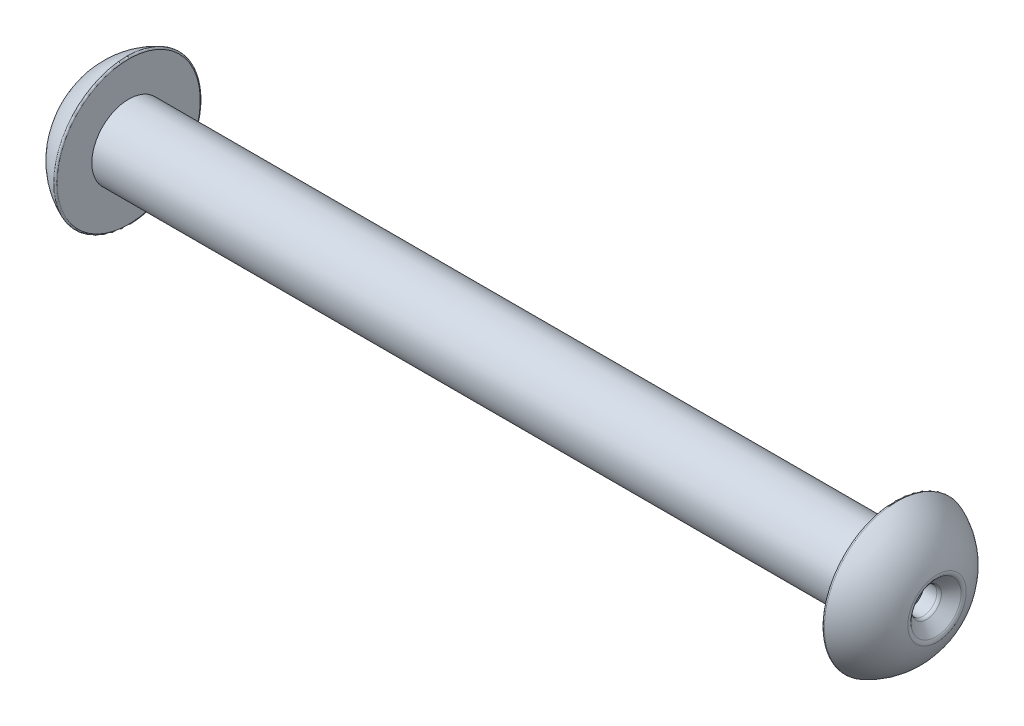
from build123d import *

# Parameters (mm, degrees)
SKETCH1_R           = 2.5000000000000004
BOSS_EXTRUDE1_DEPTH = 52
SKETCH2_R           = 5
BOSS_EXTRUDE2_DEPTH = 3
FILLET1_R           = 4.5
FILLET2_R           = 0.1
SKETCH3_R           = 0.9141726050679063
CUT_EXTRUDE2_DEPTH  = 2
CHAMFER2_SIZE       = 0.966893524
FILLET4_R           = 0.3


with BuildPart() as part:
    # Sketch1 → Boss-Extrude1 (new body)
    with BuildSketch(Plane(origin=(0, 0, 0), x_dir=(0, 0, -1), z_dir=(1, 0, 0))):
        with Locations(Location((0, 0, 0), (0, 0, 180))):
            Circle(SKETCH1_R)
    extrude(amount=BOSS_EXTRUDE1_DEPTH)

    # Sketch2 → Boss-Extrude2 (add)
    with BuildSketch(Plane(origin=(52, 0, 0), x_dir=(0, 0, -1), z_dir=(1, 0, 0))):
        Circle(SKETCH2_R)
    extrude(amount=BOSS_EXTRUDE2_DEPTH)

    # Fillet1
    # the kernel refuses this fillet: 4.5 mm, written as the material it takes off along each edge
    with BuildSketch(Plane(origin=(55, 0, 0), x_dir=(0, 0, -1), z_dir=(0, -1, 0))) as fillet1_piece_1:
        with BuildLine():
            CenterArc((0.7573593128807142, -4.5), FILLET1_R, 19.471220634490688, 70.52877936550931)
            Line((0.7573593128807142, 0), (0.7573593128807142, 0.09000000000000341))
            Line((0.7573593128807142, 0.09000000000000341), (5, 0.09000000000000341))
            Line((5, 0.09000000000000341), (5.09, 0))
            ThreePointArc((5.09, 0), (5.09, -1.5), (5.084852813742386, -2.969999999999999))
            Line((5.084852813742386, -2.969999999999999), (5, -3))
        make_face()
    revolve(axis=Axis((55, 0, 0), (1, 0, 0)), mode=Mode.SUBTRACT)

    # Fillet2
    fillet2_edges = [part.edges().sort_by_distance(p)[0] for p in [
        (52, 6.1e-16, 5),
    ]]
    fillet(fillet2_edges, radius=FILLET2_R)

    # Sketch3 → Cut-Extrude2 (cut)
    with BuildSketch(Plane(origin=(55, 0, 0), x_dir=(0, 0, -1), z_dir=(1, 0, 0))):
        Circle(SKETCH3_R)
    extrude(amount=-CUT_EXTRUDE2_DEPTH, mode=Mode.SUBTRACT)

    # Chamfer2
    # the kernel refuses this chamfer: 1, 0.966893524 mm, written as the material it takes off along each edge
    with BuildSketch(Plane(origin=(54.99726690239676, -1.3886838e-10, -1.3383106e-10), x_dir=(0, 1.519058447411492e-10, -1.0), z_dir=(0, 1.0, 1.519058447411492e-10))) as chamfer2_piece_1:
        with BuildLine():
            Line((1.8179357472686162, 0.12403267277841934), (0.9141726049340748 + CHAMFER2_SIZE * 2.76827336351e-10, CHAMFER2_SIZE))
            Line((0.9141726049340748 + CHAMFER2_SIZE * 2.76827336351e-10, CHAMFER2_SIZE), (0.9141726049340748, 0))
            ThreePointArc((0.9141726049340748, 0), (1.3817426920873381, 0.04079459843951838), (1.8179357472686162, 0.12403267277841934))
        make_face()
    revolve(axis=Axis((54.99726690239676, -1.3886838e-10, -1.3383106e-10), (-1, 0, 0)), mode=Mode.SUBTRACT)

    # Fillet4
    fillet4_edges = [part.edges().sort_by_distance(p)[0] for p in [
        (54.030373378397, -2.7795435e-10, 0.9141726050676625),
        (54.873234229619, -4.1532646e-10, 1.8179357471350002),
    ]]
    fillet(fillet4_edges, radius=FILLET4_R)

    # Mirror3: read off the stored shape, not the designer's step
    # Mirror3 outline → Mirror3 (revolve)
    with BuildSketch(Plane.YX):
        with BuildLine():
            ThreePointArc((2.300245804, -2.727233289), (3.903816696, -1.717111427), (4.949293717, -0.136363636))
            ThreePointArc((4.949293717, -0.136363636), (4.938711901, -0.043592392), (4.856139619, 0))
            Line((4.856139619, 0), (0, 0))
            Line((0, 0), (0, -1))
            Line((0, -1), (0.914172605, -1))
            Line((0.914172605, -1), (0.914172605, -1.710630444))
            ThreePointArc((0.914172605, -1.710630444), (0.945959239, -1.845023861), (1.034583208, -1.950937849))
            Line((1.034583208, -1.950937849), (2.017797308, -2.68572514))
            ThreePointArc((2.017797308, -2.68572514), (2.153767715, -2.74222977), (2.300245804, -2.727233289))
        make_face()
    revolve(axis=Axis((0, 0, 0), (1, 0, 0)))


solid = part.part
